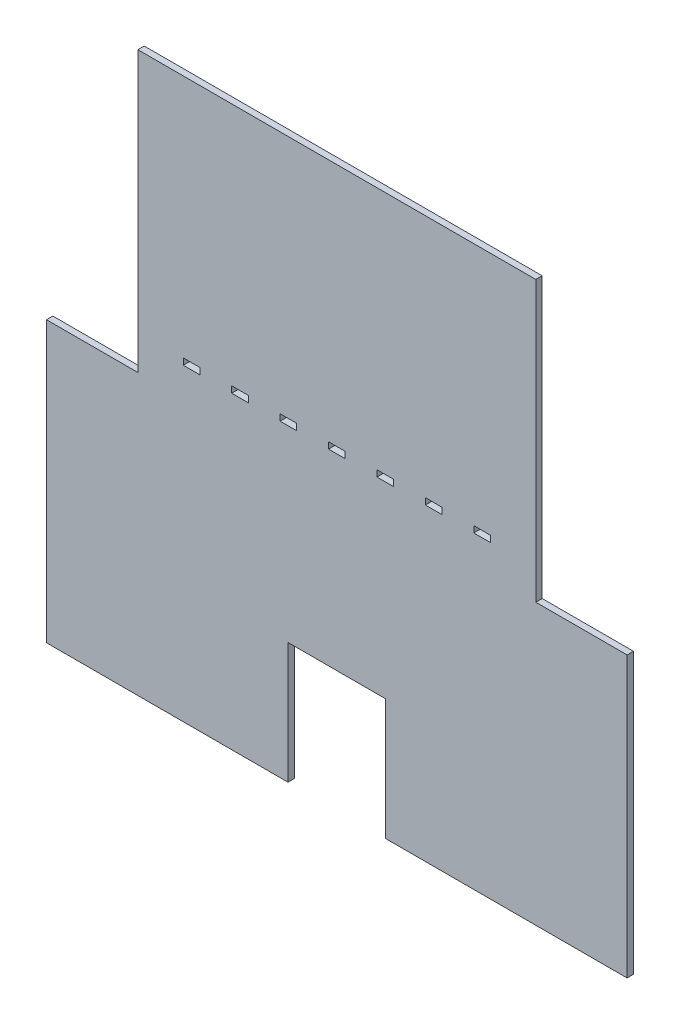
from build123d import *

# Parameters (mm, degrees)
SKETCH1_W            = 273.4
SKETCH1_H            = 263.4
BOSS_EXTRUDE1_DEPTH  = 3
SKETCH2_W            = 43
SKETCH2_H            = 131.64
CUT_EXTRUDE1_DEPTH   = 380.652630703
SKETCH3_W            = 46
SKETCH3_H            = 57
CUT_EXTRUDE2_DEPTH   = 380.652630703
SKETCH5_W            = 7.8
SKETCH5_H            = 3
CUT_EXTRUDE3_DEPTH   = 380.652630703
LPATTERN2_COUNT      = 4
LPATTERN2_PITCH      = 22.8
LPATTERN2_COUNT_DIR2 = 4
LPATTERN2_PITCH_DIR2 = 22.8


with BuildPart() as part:
    # Sketch1 → Boss-Extrude1 (new body)
    with BuildSketch(Plane.XY):
        with Locations((136.7, -131.7)):
            Rectangle(SKETCH1_W, SKETCH1_H)
    extrude(amount=BOSS_EXTRUDE1_DEPTH)

    # Sketch2 → Cut-Extrude1 (cut, through all)
    with BuildSketch(Plane.XY.offset(3)):
        with Locations((21.5, -65.82)):
            Rectangle(SKETCH2_W, SKETCH2_H)
        with Locations((251.9, -65.82)):
            Rectangle(SKETCH2_W, SKETCH2_H)
    extrude(amount=-CUT_EXTRUDE1_DEPTH, mode=Mode.SUBTRACT)

    # Sketch3 → Cut-Extrude2 (cut, through all)
    with BuildSketch(Plane(origin=(0, 0, 0), x_dir=(-1, 0, 0), z_dir=(0, 0, -1))):
        with Locations((-136.7, -234.9)):
            Rectangle(SKETCH3_W, SKETCH3_H)
    extrude(amount=-CUT_EXTRUDE2_DEPTH, mode=Mode.SUBTRACT)

    # Sketch5 → Cut-Extrude3 (cut, through all)
    with BuildSketch(Plane(origin=(0, 0, 0), x_dir=(-1, 0, 0), z_dir=(0, 0, -1))):
        with Locations((-136.7, -116.5)):
            Rectangle(SKETCH5_W, SKETCH5_H)
    cut_extrude3 = extrude(amount=-CUT_EXTRUDE3_DEPTH, mode=Mode.SUBTRACT)

    # LPattern2: Cut-Extrude3 4 × 4
    with Locations(*[Vector(1, 0, 0) * (i * LPATTERN2_PITCH) + Vector(-1, 0, 0) * (j * LPATTERN2_PITCH_DIR2) for i in range(LPATTERN2_COUNT) for j in range(LPATTERN2_COUNT_DIR2) if (i, j) != (0, 0)]):
        add(cut_extrude3, mode=Mode.SUBTRACT)


solid = part.part
